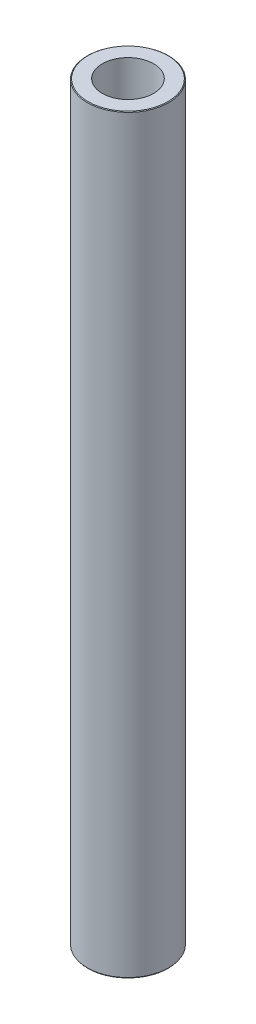
from build123d import *
from OCP.BRepFilletAPI import BRepFilletAPI_MakeChamfer

# Parameters (mm, degrees)
SKETCH1_R           = 32.5
BOSS_EXTRUDE1_DEPTH = 600
SKETCH2_R           = 20.559515041
CUT_EXTRUDE1_DEPTH  = 602.757841661
CHAMFER1_SIZE       = 0.432074836
CHAMFER1_SIZE2      = 0.597846863


with BuildPart() as part:
    # Sketch1 → Boss-Extrude1 (new body)
    with BuildSketch(Plane(origin=(0, 0, 0), x_dir=(1, 0, 0), z_dir=(0, 1, 0))):
        Circle(SKETCH1_R)
    extrude(amount=BOSS_EXTRUDE1_DEPTH)

    # Sketch2 → Cut-Extrude1 (cut, through all)
    with BuildSketch(Plane(origin=(0, 0, 0), x_dir=(1, 0, 0), z_dir=(0, 1, 0))):
        Circle(SKETCH2_R)
    extrude(amount=CUT_EXTRUDE1_DEPTH, mode=Mode.SUBTRACT)

    # Chamfer1: one chamfer whose edges measure the first distance from different faces: ONE call of the kernel's chamfer builder (chamfer() names one face for all edges)
    chamfer1_edges_1 = [part.edges().sort_by_distance(p)[0] for p in [
        (-32.5, 600, 0),
    ]]
    chamfer1_side_1 = [part.faces().sort_by_distance(p)[0] for p in [
        (-32.5, 300, 0),
    ]]
    chamfer1_edges_2 = [part.edges().sort_by_distance(p)[0] for p in [
        (-32.5, 0, 0),
    ]]
    chamfer1_side_2 = [part.faces().sort_by_distance(p)[0] for p in [
        (-31.580761184, 0, 0),
    ]]
    chamfer1 = BRepFilletAPI_MakeChamfer(part.part.solid().wrapped)
    for e in chamfer1_edges_1:
        chamfer1.Add(CHAMFER1_SIZE, CHAMFER1_SIZE2, e.wrapped, chamfer1_side_1[0].wrapped)  # the first distance lies on this face
    for e in chamfer1_edges_2:
        chamfer1.Add(CHAMFER1_SIZE, CHAMFER1_SIZE2, e.wrapped, chamfer1_side_2[0].wrapped)  # the first distance lies on this face
    add(Compound.cast(chamfer1.Shape()), mode=Mode.REPLACE)


solid = part.part
